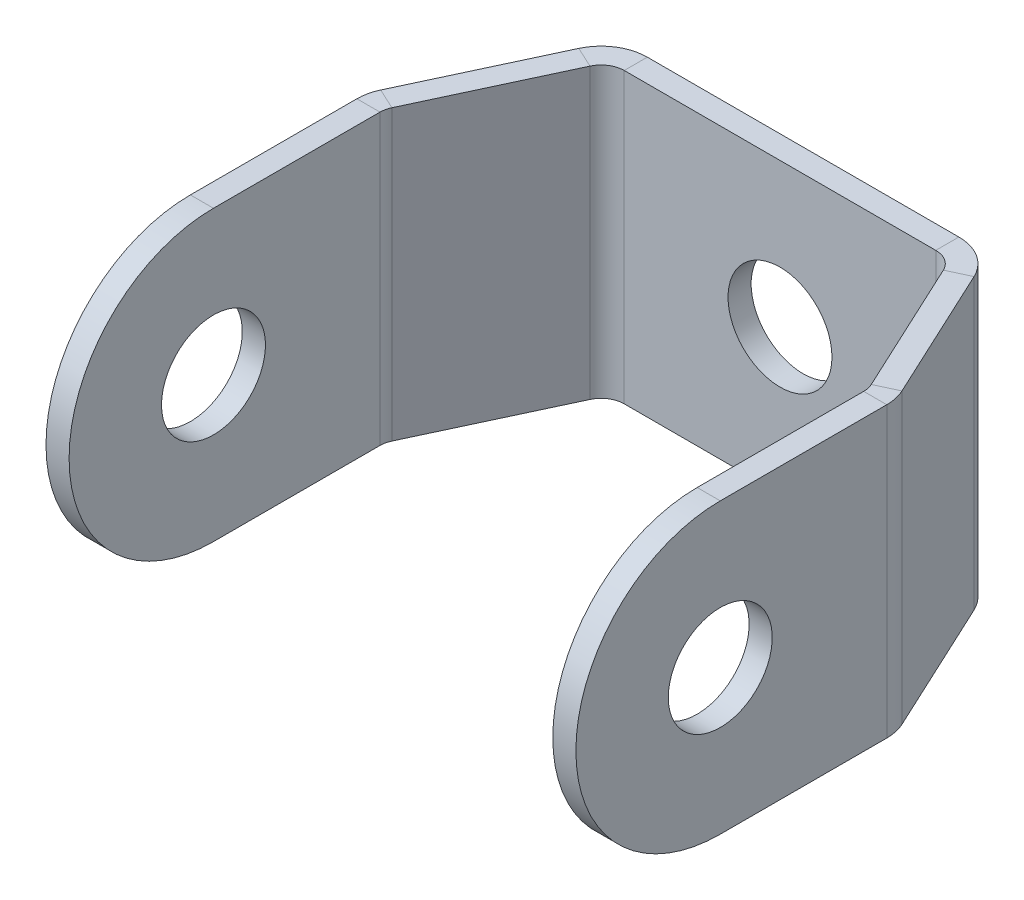
from build123d import *

# Parameters (mm, degrees)
SKETCH1_R                  = 4.5
EXTRUDE1_DEPTH             = 2
PROCESS_BENDS1_START       = -58
PROCESS_BENDS1_OUTLINE_W   = 25
PROCESS_BENDS1_OUTLINE_H   = 2
PROCESS_BENDS1_DEPTH       = 40.887009382
PROCESS_BENDS1_START_2     = 17.112990618
PROCESS_BENDS1_2_OUTLINE_W = 25
PROCESS_BENDS1_2_OUTLINE_H = 2
PROCESS_BENDS1_2_DEPTH     = 40.887009382
PROCESS_BENDS1_START_3     = 13.596613306
PROCESS_BENDS1_3_OUTLINE_R = 4.5
PROCESS_BENDS1_3_DEPTH     = 9.345511755
PROCESS_BENDS1_START_4     = -22.942125061
PROCESS_BENDS1_4_OUTLINE_R = 4.5
PROCESS_BENDS1_4_DEPTH     = 9.157953378
PROCESS_BENDS1_START_5     = -12.5
PROCESS_BENDS1_5_DEPTH     = 25
PROCESS_BENDS1_6_DEPTH     = 25


with BuildPart() as part:
    # Sketch1 → Extrude1 (new body)
    with BuildSketch(Plane.XY):
        with BuildLine():
            Line((-45, 12.5), (45, 12.5))
            ThreePointArc((45, 12.5), (57.5, 0), (45, -12.5))
            Line((45, -12.5), (-45, -12.5))
            ThreePointArc((-45, -12.5), (-57.5, 0), (-45, 12.5))
        make_face()
        with Locations((45, 0)):
            Circle(SKETCH1_R, mode=Mode.SUBTRACT)
        with Locations(Location((-45, 0, 0), (0, 0, 180))):
            Circle(SKETCH1_R, mode=Mode.SUBTRACT)
        Circle(SKETCH1_R, mode=Mode.SUBTRACT)
    extrude(amount=EXTRUDE1_DEPTH)

    # Process-Bends1: read off the stored shape, not the designer's step
    # Process-Bends1 outline → Process-Bends1 (cut)
    with BuildSketch(Plane.YZ.offset(PROCESS_BENDS1_START)):
        with Locations((0, 1)):
            Rectangle(PROCESS_BENDS1_OUTLINE_W, PROCESS_BENDS1_OUTLINE_H)
    extrude(amount=PROCESS_BENDS1_DEPTH, mode=Mode.SUBTRACT)

    # Process-Bends1 2 outline → Process-Bends1 2 (cut)
    with BuildSketch(Plane.YZ.offset(PROCESS_BENDS1_START_2)):
        with Locations((0, 1)):
            Rectangle(PROCESS_BENDS1_2_OUTLINE_W, PROCESS_BENDS1_2_OUTLINE_H)
    extrude(amount=PROCESS_BENDS1_2_DEPTH, mode=Mode.SUBTRACT)

    # Process-Bends1 3 outline → Process-Bends1 3 (add)
    with BuildSketch(Plane.YZ.offset(PROCESS_BENDS1_START_3)):
        with BuildLine():
            ThreePointArc((12.5, 30.115293784), (0, 42.615293784), (-12.5, 30.115293784))
            Line((-12.5, 30.115293784), (-12.5, 2))
            Line((-12.5, 2), (12.5, 2))
            Line((12.5, 2), (12.5, 30.115293784))
        make_face()
        with Locations((0, 30.115293784)):
            Circle(PROCESS_BENDS1_3_OUTLINE_R, mode=Mode.SUBTRACT)
    extrude(amount=PROCESS_BENDS1_3_DEPTH)

    # Process-Bends1 4 outline → Process-Bends1 4 (add)
    with BuildSketch(Plane.YZ.offset(PROCESS_BENDS1_START_4)):
        with BuildLine():
            ThreePointArc((12.5, 30.115293784), (0, 42.615293784), (-12.5, 30.115293784))
            Line((-12.5, 30.115293784), (-12.5, 2))
            Line((-12.5, 2), (12.5, 2))
            Line((12.5, 2), (12.5, 30.115293784))
        make_face()
        with Locations((0, 30.115293784)):
            Circle(PROCESS_BENDS1_4_OUTLINE_R, mode=Mode.SUBTRACT)
    extrude(amount=PROCESS_BENDS1_4_DEPTH)

    # Process-Bends1 5 outline → Process-Bends1 5 (cut)
    with BuildSketch(Plane(origin=(0, 0, 0), x_dir=(1, 0, 0), z_dir=(0, 1, 0)).offset(PROCESS_BENDS1_START_5)):
        with BuildLine():
            ThreePointArc((-20.754740635, -14.851688233), (-20.894717075, -15.264045529), (-20.942125061, -15.696924757))
            Line((-20.942125061, -15.696924757), (-20.942125061, -44))
            Line((-20.942125061, -44), (-13.784171683, -44))
            Line((-13.784171683, -44), (-13.784171683, -2.022087009))
            ThreePointArc((-13.784171683, -2.022087009), (-14.684730041, -2.397732403), (-15.300375044, -3.154763477))
            Line((-15.300375044, -3.154763477), (-20.754740635, -14.851688233))
        make_face()
        with BuildLine():
            Line((13.596613306, -2.002964486), (13.596613306, -44))
            Line((13.596613306, -44), (20.942125061, -44))
            Line((20.942125061, -44), (20.942125061, -15.696924757))
            ThreePointArc((20.942125061, -15.696924757), (20.894717075, -15.264045529), (20.754740635, -14.851688233))
            Line((20.754740635, -14.851688233), (15.300375044, -3.154763477))
            ThreePointArc((15.300375044, -3.154763477), (14.607880625, -2.343096684), (13.596613306, -2.002964486))
        make_face()
        with BuildLine():
            Line((-22.942125061, -2), (-22.942125061, -15.696924757))
            ThreePointArc((-22.942125061, -15.696924757), (-22.847309089, -14.831166301), (-22.567356209, -14.00645171))
            Line((-22.567356209, -14.00645171), (-17.112990618, -2.309526953))
            ThreePointArc((-17.112990618, -2.309526953), (-15.636957903, -0.626434217), (-13.48775947, 0))
            Line((-13.48775947, 0), (-17.112990618, 0))
            Line((-17.112990618, 0), (-17.112990618, -2))
            Line((-17.112990618, -2), (-22.942125061, -2))
        make_face()
        with BuildLine():
            Line((22.942125061, -2), (17.112990618, -2))
            Line((17.112990618, -2), (17.112990618, 0))
            Line((17.112990618, 0), (13.48775947, 0))
            ThreePointArc((13.48775947, 0), (15.636957903, -0.626434217), (17.112990618, -2.309526953))
            Line((17.112990618, -2.309526953), (22.567356209, -14.00645171))
            ThreePointArc((22.567356209, -14.00645171), (22.847309089, -14.831166301), (22.942125061, -15.696924757))
            Line((22.942125061, -15.696924757), (22.942125061, -2))
        make_face()
    extrude(amount=PROCESS_BENDS1_5_DEPTH, mode=Mode.SUBTRACT)

    # Process-Bends1 6 outline → Process-Bends1 6 (add)
    with BuildSketch(Plane(origin=(0, 0, 0), x_dir=(1, 0, 0), z_dir=(0, 1, 0)).offset(PROCESS_BENDS1_START_5)):
        with BuildLine():
            Line((-13.784171683, -2), (-13.784171683, -2.022087009))
            ThreePointArc((-13.784171683, -2.022087009), (-13.636376458, -2.005529396), (-13.48775947, -2))
            Line((-13.48775947, -2), (-13.784171683, -2))
        make_face()
        with BuildLine():
            Line((13.596613306, -2.000000001), (13.48775947, -2))
            ThreePointArc((13.48775947, -2), (13.542206568, -2.000741259), (13.596613306, -2.002964486))
            Line((13.596613306, -2.002964486), (13.596613306, -2.000000001))
        make_face()
    extrude(amount=PROCESS_BENDS1_6_DEPTH)


solid = part.part
